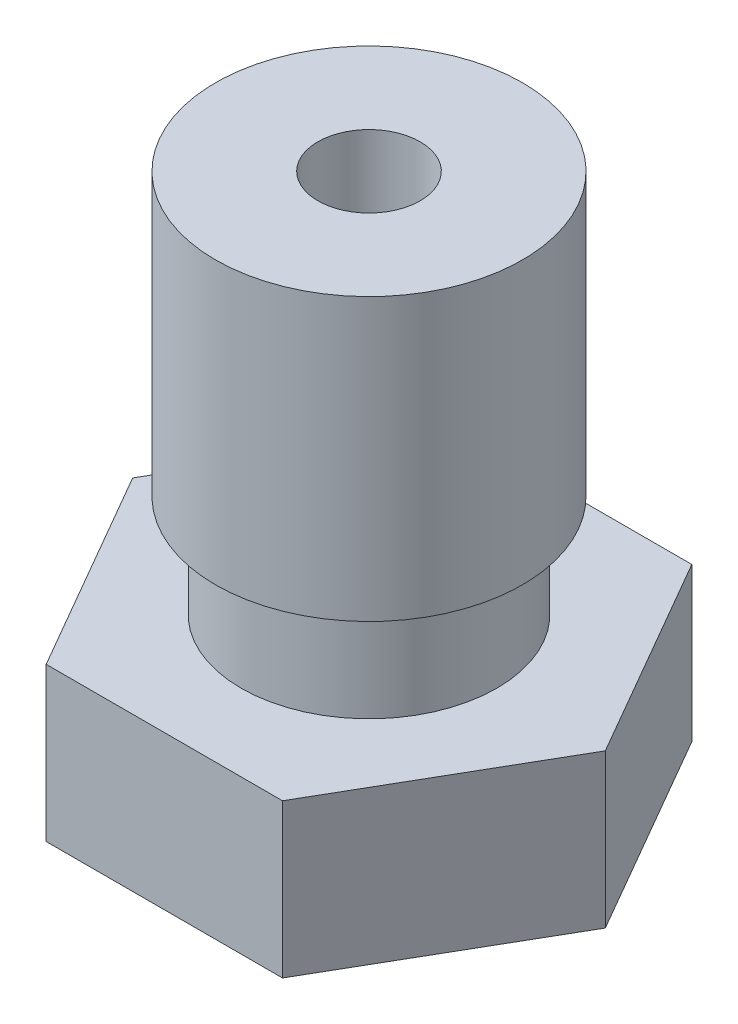
from build123d import *

# Parameters (mm, degrees)
SKETCH1_R           = 1
BOSS_EXTRUDE1_DEPTH = 3


with BuildPart() as part:
    # Sketch1 → Boss-Extrude1 (new body)
    with BuildSketch(Plane(origin=(0, 0, 0), x_dir=(1, 0, 0), z_dir=(0, 1, 0))):
        Polygon((2.309401077, 4), (-2.309401077, 4), (-4.618802154, 0), (-2.309401077, -4), (2.309401077, -4), (4.618802154, 0), align=None)
        Circle(SKETCH1_R, mode=Mode.SUBTRACT)
    extrude(amount=BOSS_EXTRUDE1_DEPTH)

    # Sketch2 → Revolve1 (revolve)
    with BuildSketch(Plane.XY):
        Polygon((2.000415076, 0), (1, 0), (0.225, -2), (0.6, -2), align=None)
        Polygon((1, 10.5), (1, 3), (2.5, 3), (2.5, 5), (3, 5), (3, 10.5), align=None)
    revolve(axis=Axis((0, -2, 0), (0, 1, 0)))


solid = part.part
